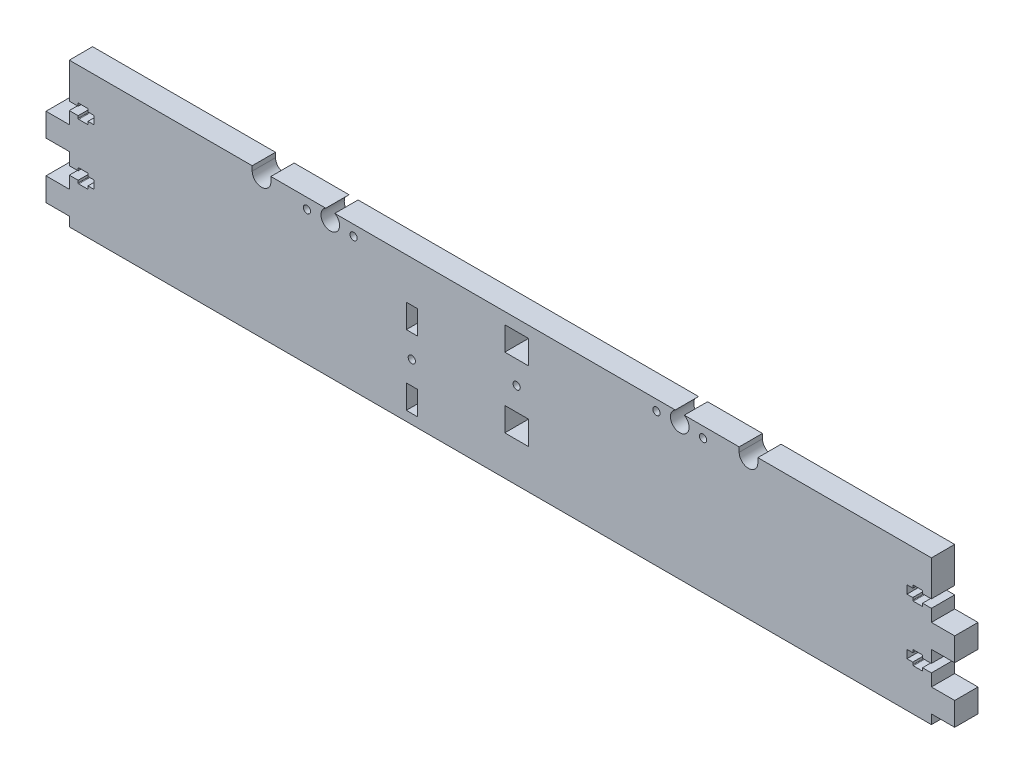
from build123d import *

# Parameters (mm, degrees)
MAINBODY_DEPTH      = 10
SCREWCUTOUTS_DEPTH  = 205.863369102
SKETCH2_R           = 4
SKETCH2_R_2         = 1.55
RODCUTOUTS_DEPTH    = 205.863369102
SKETCH4_R           = 1.55
SKETCH4_W           = 10.2
SKETCH4_H           = 10.2
CUT_EXTRUDE3_DEPTH  = 205.863369102
SKETCH5_R           = 1.55
SKETCH5_W           = 4.7
SKETCH5_H           = 10.2
ENDSTOPHOLDER_DEPTH = 205.863369102
CUT_EXTRUDE4_DEPTH  = 205.863369102


with BuildPart() as part:
    # Sketch1 → MainBody (new body)
    with BuildSketch(Plane.XY):
        Polygon((0, 0), (-185, 0), (-185, -24), (-195, -24), (-195, -34), (-185, -34), (-185, -48), (-195, -48), (-195, -58), (-185, -58), (-185, -62), (0, -62), align=None)
    mainbody = extrude(amount=MAINBODY_DEPTH)

    # Sketch3 → ScrewCutouts (cut, through all)
    with BuildSketch(Plane.XY.offset(10)):
        with BuildLine():
            Line((-185, -18.75), (-181.2, -18.75))
            Line((-181.2, -18.75), (-181.2, -19.75))
            ThreePointArc((-181.2, -19.75), (-181.126776695, -19.926776695), (-180.95, -20))
            Line((-180.95, -20), (-177.25, -20))
            ThreePointArc((-177.25, -20), (-177.073223305, -19.926776695), (-177, -19.75))
            Line((-177, -19.75), (-177, -18.75))
            Line((-177, -18.75), (-174.5, -18.75))
            Line((-174.5, -18.75), (-174.5, -15.25))
            Line((-174.5, -15.25), (-177, -15.25))
            Line((-177, -15.25), (-177, -14.25))
            ThreePointArc((-177, -14.25), (-177.073223305, -14.073223305), (-177.25, -14))
            Line((-177.25, -14), (-180.95, -14))
            ThreePointArc((-180.95, -14), (-181.126776695, -14.073223305), (-181.2, -14.25))
            Line((-181.2, -14.25), (-181.2, -15.25))
            Line((-181.2, -15.25), (-185, -15.25))
            Line((-185, -15.25), (-185, -18.75))
        make_face()
        with BuildLine():
            Line((-185, -39.25), (-185, -42.75))
            Line((-185, -42.75), (-181.2, -42.75))
            Line((-181.2, -42.75), (-181.2, -43.75))
            ThreePointArc((-181.2, -43.75), (-181.126776695, -43.926776695), (-180.95, -44))
            Line((-180.95, -44), (-177.25, -44))
            ThreePointArc((-177.25, -44), (-177.073223305, -43.926776695), (-177, -43.75))
            Line((-177, -43.75), (-177, -42.75))
            Line((-177, -42.75), (-174.5, -42.75))
            Line((-174.5, -42.75), (-174.5, -39.25))
            Line((-174.5, -39.25), (-177, -39.25))
            Line((-177, -39.25), (-177, -38.25))
            ThreePointArc((-177, -38.25), (-177.073223305, -38.073223305), (-177.25, -38))
            Line((-177.25, -38), (-180.95, -38))
            ThreePointArc((-180.95, -38), (-181.126776695, -38.073223305), (-181.2, -38.25))
            Line((-181.2, -38.25), (-181.2, -39.25))
            Line((-181.2, -39.25), (-185, -39.25))
        make_face()
    screwcutouts = extrude(amount=-SCREWCUTOUTS_DEPTH, mode=Mode.SUBTRACT)

    # Mirror1: MainBody, ScrewCutouts across plane
    add(mainbody.mirror(Plane(origin=(0, 0, 0), x_dir=(0, 0, 1), z_dir=(1, 0, 0))))
    add(screwcutouts.mirror(Plane(origin=(0, 0, 0), x_dir=(0, 0, 1), z_dir=(1, 0, 0))), mode=Mode.SUBTRACT)

    # Sketch2 → RodCutouts (cut, through all)
    with BuildSketch(Plane.XY.offset(10)):
        with Locations((-73, -3.5)):
            Circle(SKETCH2_R)
        with Locations((-83, -4.5)):
            Circle(SKETCH2_R_2)
        with Locations((-63, -4.5)):
            Circle(SKETCH2_R_2)
        with Locations((67, -4.5)):
            Circle(SKETCH2_R_2)
        with Locations((87, -4.5)):
            Circle(SKETCH2_R_2)
        with Locations((77, -3.5)):
            Circle(SKETCH2_R)
    extrude(amount=-RODCUTOUTS_DEPTH, mode=Mode.SUBTRACT)

    # Sketch4 → Cut-Extrude3 (cut, through all)
    with BuildSketch(Plane.XY.offset(10)):
        with Locations((7, -25)):
            Circle(SKETCH4_R)
        with Locations((7, -10)):
            Rectangle(SKETCH4_W, SKETCH4_H)
        with Locations((7, -40)):
            Rectangle(SKETCH4_W, SKETCH4_H)
    extrude(amount=-CUT_EXTRUDE3_DEPTH, mode=Mode.SUBTRACT)

    # Sketch5 → EndstopHolder (cut, through all)
    with BuildSketch(Plane.XY.offset(10)):
        with Locations((-38, -37.75)):
            Circle(SKETCH5_R)
        with Locations((-38, -22.75)):
            Rectangle(SKETCH5_W, SKETCH5_H)
        with Locations((-38, -52.75)):
            Rectangle(SKETCH5_W, SKETCH5_H)
        with BuildLine():
            Line((-28.25, 8.994431211), (-28.25, 5))
            ThreePointArc((-28.25, 5), (-31.45, 1.8), (-34.65, 5))
            Line((-34.65, 5), (-34.65, 8.994431211))
            ThreePointArc((-34.65, 8.994431211), (-31.45, 12.194431211), (-28.25, 8.994431211))
        make_face()
    extrude(amount=-ENDSTOPHOLDER_DEPTH, mode=Mode.SUBTRACT)

    # Sketch7 → Cut-Extrude4 (cut, through all)
    with BuildSketch(Plane.XY.offset(10)):
        with BuildLine():
            Line((-98.5, 0), (-98.5, -2))
            ThreePointArc((-98.5, -2), (-102.5, -6), (-106.5, -2))
            Line((-106.5, -2), (-106.5, 0))
            ThreePointArc((-106.5, 0), (-102.5, 4), (-98.5, 0))
        make_face()
        with BuildLine():
            Line((102.5, 0), (102.5, -2))
            ThreePointArc((102.5, -2), (106.5, -6), (110.5, -2))
            Line((110.5, -2), (110.5, 0))
            ThreePointArc((110.5, 0), (106.5, 4), (102.5, 0))
        make_face()
    extrude(amount=-CUT_EXTRUDE4_DEPTH, mode=Mode.SUBTRACT)


solid = part.part
